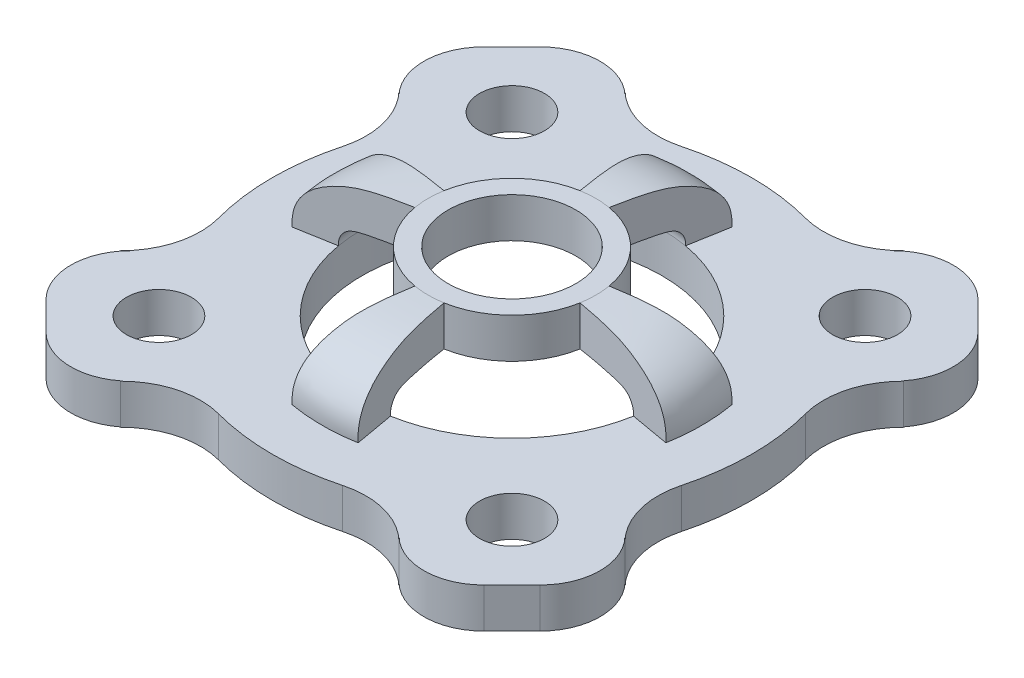
from build123d import *

# Parameters (mm, degrees)
SKETCH21_R          = 1.625
SKETCH21_R_2        = 7.5
MAIN_DEPTH          = 2
SKETCH23_R          = 4.2
SKETCH23_R_2        = 3.2
BOSS_EXTRUDE1_DEPTH = 2
REVOLVE1_START      = 2
REVOLVE1_DEPTH      = 3.0000001
REVOLVE1_2_ANGLE    = 20
REVOLVE1_3_ANGLE    = 20
CIRPATTERN1_COUNT   = 4


with BuildPart() as part:
    # Sketch21 → Main (new body)
    with BuildSketch(Plane(origin=(0, 0, 0), x_dir=(1, 0, 0), z_dir=(0, 1, 0))):
        with BuildLine():
            Line((-12.374368671, 10.960155108), (-10.960155108, 12.374368671))
            ThreePointArc((-10.960155108, 12.374368671), (-8.838834765, 13.253048327), (-6.717514421, 12.374368671))
            Line((-6.717514421, 12.374368671), (-6.969531846, 12.626386096))
            ThreePointArc((-6.969531846, 12.626386096), (-5.176380902, 11.591109915), (-3.105828541, 11.591109915))
            ThreePointArc((-3.105828541, 11.591109915), (0, 12), (3.105828541, 11.591109915))
            ThreePointArc((3.105828541, 11.591109915), (5.176380902, 11.591109915), (6.969531846, 12.626386096))
            Line((6.969531846, 12.626386096), (6.717514421, 12.374368671))
            ThreePointArc((6.717514421, 12.374368671), (8.838834765, 13.253048327), (10.960155108, 12.374368671))
            Line((10.960155108, 12.374368671), (12.374368671, 10.960155108))
            ThreePointArc((12.374368671, 10.960155108), (13.253048327, 8.838834765), (12.374368671, 6.717514421))
            Line((12.374368671, 6.717514421), (12.626386096, 6.969531846))
            ThreePointArc((12.626386096, 6.969531846), (11.591109915, 5.176380902), (11.591109915, 3.105828541))
            ThreePointArc((11.591109915, 3.105828541), (12, 0), (11.591109915, -3.105828541))
            ThreePointArc((11.591109915, -3.105828541), (11.591109915, -5.176380902), (12.626386096, -6.969531846))
            Line((12.626386096, -6.969531846), (12.374368671, -6.717514421))
            ThreePointArc((12.374368671, -6.717514421), (13.253048327, -8.838834765), (12.374368671, -10.960155108))
            Line((12.374368671, -10.960155108), (10.960155108, -12.374368671))
            ThreePointArc((10.960155108, -12.374368671), (8.838834765, -13.253048327), (6.717514421, -12.374368671))
            Line((6.717514421, -12.374368671), (6.969531846, -12.626386096))
            ThreePointArc((6.969531846, -12.626386096), (5.176380902, -11.591109915), (3.105828541, -11.591109915))
            ThreePointArc((3.105828541, -11.591109915), (0, -12), (-3.105828541, -11.591109915))
            ThreePointArc((-3.105828541, -11.591109915), (-5.176380902, -11.591109915), (-6.969531846, -12.626386096))
            Line((-6.969531846, -12.626386096), (-6.717514421, -12.374368671))
            ThreePointArc((-6.717514421, -12.374368671), (-8.838834765, -13.253048327), (-10.960155108, -12.374368671))
            Line((-10.960155108, -12.374368671), (-12.374368671, -10.960155108))
            ThreePointArc((-12.374368671, -10.960155108), (-13.253048327, -8.838834765), (-12.374368671, -6.717514421))
            Line((-12.374368671, -6.717514421), (-12.626386096, -6.969531846))
            ThreePointArc((-12.626386096, -6.969531846), (-11.591109915, -5.176380902), (-11.591109915, -3.105828541))
            ThreePointArc((-11.591109915, -3.105828541), (-12, 0), (-11.591109915, 3.105828541))
            ThreePointArc((-11.591109915, 3.105828541), (-11.591109915, 5.176380902), (-12.626386096, 6.969531846))
            Line((-12.626386096, 6.969531846), (-12.374368671, 6.717514421))
            ThreePointArc((-12.374368671, 6.717514421), (-13.253048327, 8.838834765), (-12.374368671, 10.960155108))
        make_face()
        with Locations(Location((8.838834765, 8.838834765, 0), (0, 0, 270))):
            Circle(SKETCH21_R, mode=Mode.SUBTRACT)
        with Locations(Location((8.838834765, -8.838834765, 0), (0, 0, 270))):
            Circle(SKETCH21_R, mode=Mode.SUBTRACT)
        with Locations(Location((-8.838834765, -8.838834765, 0), (0, 0, 270))):
            Circle(SKETCH21_R, mode=Mode.SUBTRACT)
        with Locations(Location((-8.838834765, 8.838834765, 0), (0, 0, 270))):
            Circle(SKETCH21_R, mode=Mode.SUBTRACT)
        with Locations(Location((0, 0, 0), (0, 0, 270))):
            Circle(SKETCH21_R_2, mode=Mode.SUBTRACT)
    extrude(amount=MAIN_DEPTH)



with BuildPart() as body_2:
    # Sketch23 → Boss-Extrude1 (new body)
    with BuildSketch(Plane(origin=(0, 5, 0), x_dir=(1, 0, 0), z_dir=(0, 1, 0))):
        with Locations(Location((0, 0, 0), (0, 0, 270))):
            Circle(SKETCH23_R)
        with Locations(Location((0, 0, 0), (0, 0, 270))):
            Circle(SKETCH23_R_2, mode=Mode.SUBTRACT)
    extrude(amount=-BOSS_EXTRUDE1_DEPTH)


with BuildPart() as part_1:
    add(part.part)

    add(body_2.part)  # Revolve1 merges body 2
    # Revolve1: read off the stored shape, not the designer's step
    # Revolve1 outline → Revolve1 (add)
    with BuildSketch(Plane(origin=(0, 0, 0), x_dir=(1, 0, 0), z_dir=(0, 1, 0)).offset(REVOLVE1_START)):
        with BuildLine():
            ThreePointArc((-7.386058148, 1.302361332), (-7.5, 0), (-7.386058148, -1.302361332))
            Line((-7.386058148, -1.302361332), (-4.136192563, -0.729322346))
            ThreePointArc((-4.136192563, -0.729322346), (-4.2, 0), (-4.136192563, 0.729322346))
            Line((-4.136192563, 0.729322346), (-7.386058148, 1.302361332))
        make_face()
    revolve1 = extrude(amount=REVOLVE1_DEPTH)

    # Revolve1 2 outline → Revolve1 2 (revolve, cut)
    with BuildSketch(Plane(origin=(0, 0, 0), x_dir=(-0.9848077530122078, 0, -0.17364817766693202), z_dir=(0.17364817766693202, 0, -0.9848077530122078))):
        with BuildLine():
            Line((7.5, 5.0000001), (4.2, 5))
            add(Edge.make_bspline(
                [(4.2, 5), (5.982635205, 4.992310164), (6.774082879, 4.851938269), (7.492555324, 4.584836693), (7.5, 4.582052306)],
                knots=[0, 0, 0, 0, 0.380988924, 0.384982373, 0.384982373, 0.384982373, 0.384982373], degree=3))
            Line((7.5, 4.582052306), (7.5, 5.0000001))
        make_face()
        with BuildLine():
            Line((5.505892852, 3), (4.2, 3))
            Line((4.2, 3), (4.2, 2))
            Line((4.2, 2), (7.5, 2))
            Line((7.5, 2), (7.5, 2.168694052))
            add(Edge.make_bspline(
                [(7.5, 2.168694052), (7.474165676, 2.402361508), (7.259227976, 2.776784864), (6.698722273, 2.938737477), (6.279860406, 2.965955752), (5.872473083, 2.987273734), (5.643353064, 2.995990887), (5.505892852, 3)],
                knots=[0.04346167, 0.04346167, 0.04346167, 0.04346167, 0.224146676, 0.342653564, 0.481775745, 0.553286067, 0.660507352, 0.660507352, 0.660507352, 0.660507352], degree=3))
        make_face()
        with BuildLine():
            add(Edge.make_bspline(
                [(5.505892852, 3), (5.070655283, 3.012693977), (4.635308795, 3.013153878), (4.2, 3)],
                knots=[0.660507352, 0.660507352, 0.660507352, 0.660507352, 1, 1, 1, 1], degree=3))
            Line((4.2, 3), (5.505892852, 3))
        make_face()
    revolve1_2 = revolve(axis=Axis((0, 0, 0), (0, 1, 0)), revolution_arc=REVOLVE1_2_ANGLE, mode=Mode.SUBTRACT)

    # Revolve1 3 outline → Revolve1 3 (revolve)
    with BuildSketch(Plane(origin=(0, 0, 0), x_dir=(-0.9848077530122078, 0, -0.17364817766693202), z_dir=(0.17364817766693202, 0, -0.9848077530122078))):
        with BuildLine():
            Line((7.5, 4.582052306), (7.5, 2.168694052))
            add(Edge.make_bspline(
                [(7.5, 2), (7.506412796, 2.055845291), (7.506214145, 2.112488071), (7.5, 2.168694052)],
                knots=[0, 0, 0, 0, 0.04346167, 0.04346167, 0.04346167, 0.04346167], degree=3))
            Line((7.5, 2), (9.5, 2))
            add(Edge.make_bspline(
                [(9.5, 2), (9.601210283, 3.398928444), (8.64652948, 4.15323827), (7.5, 4.582052306)],
                knots=[0.969922529, 0.969922529, 0.969922529, 0.969922529, 1.584940156, 1.584940156, 1.584940156, 1.584940156], degree=3))
        make_face()
    revolve1_3 = revolve(axis=Axis((0, 0, 0), (0, 1, 0)), revolution_arc=REVOLVE1_3_ANGLE)

    # CirPattern1: Revolve1, Revolve1 2, Revolve1 3 ×4 about axis
    cirpattern1_axis = Axis((0, -52.54930657, 0), (0, 1, 0))
    add([revolve1.rotate(cirpattern1_axis, i * 360 / CIRPATTERN1_COUNT) for i in range(1, CIRPATTERN1_COUNT)])
    add([revolve1_2.rotate(cirpattern1_axis, i * 360 / CIRPATTERN1_COUNT) for i in range(1, CIRPATTERN1_COUNT)], mode=Mode.SUBTRACT)
    add([revolve1_3.rotate(cirpattern1_axis, i * 360 / CIRPATTERN1_COUNT) for i in range(1, CIRPATTERN1_COUNT)])


solid = part_1.part
